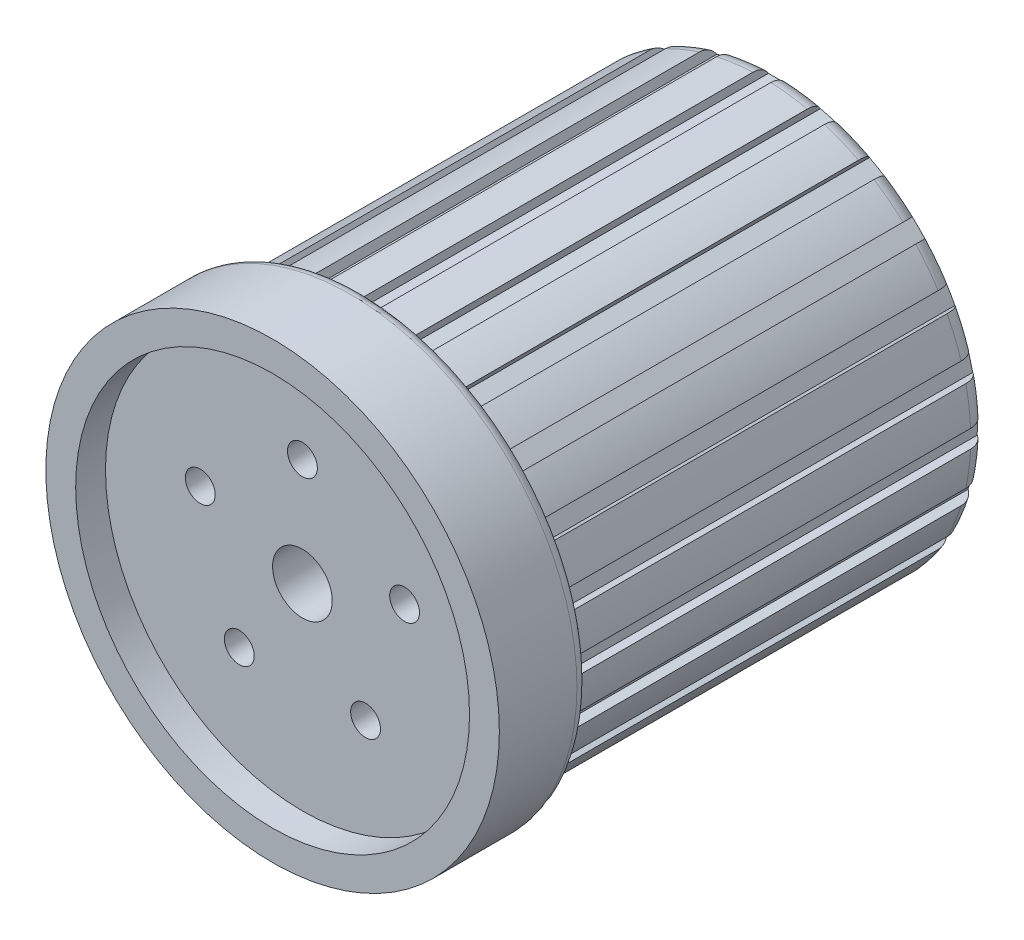
from build123d import *

# Parameters (mm, degrees)
SKETCH2_R           = 2.5
SKETCH2_R_2         = 5
CUT_EXTRUDE1_DEPTH  = 10
FILLET1_R           = 3
SKETCH3_W           = 3
SKETCH3_H           = 3
CUT_EXTRUDE2_DEPTH  = 70
SKETCH4_R           = 38
SKETCH4_R_2         = 35
BOSS_EXTRUDE1_DEPTH = 10
CIRPATTERN1_START   = -52.098076311
CIRPATTERN1_DEPTH   = 69.598076311
FILLET2_R           = 2
BOSS_EXTRUDE2_START = 5
SKETCH5_R           = 38
SKETCH5_R_2         = 33
BOSS_EXTRUDE2_DEPTH = 5


# Read off the part's stored shape, not the designer's step: CirPattern1
with BuildPart() as part:
    # Sketch1 → Revolve1 (revolve)
    with BuildSketch(Plane(origin=(0, 0, 0), x_dir=(0, 0, -1), z_dir=(1, 0, 0))):
        Polygon((-17.5, 0), (-17.5, -25), (52.5, -25), (52.5, -35), (-27.5, -35), (-27.5, 0), align=None)
    revolve(axis=Axis((0, 0, 42.5), (0, 0, -1)))

    # Sketch2 → Cut-Extrude1 (cut)
    with BuildSketch(Plane(origin=(0, 0, 17.5), x_dir=(-1, 0, 0), z_dir=(0, 0, -1))):
        with Locations(Location((0, 18, 0), (0, 0, 90))):
            Circle(SKETCH2_R)
        with Locations(Location((0, 0, 0), (0, 0, 90))):
            Circle(SKETCH2_R_2)
        with Locations(Location((17.119017293, 5.562305899, 0), (0, 0, 90))):
            Circle(SKETCH2_R)
        with Locations(Location((10.580134541, -14.562305899, 0), (0, 0, 90))):
            Circle(SKETCH2_R)
        with Locations(Location((-10.580134541, -14.562305899, 0), (0, 0, 90))):
            Circle(SKETCH2_R)
        with Locations(Location((-17.119017293, 5.562305899, 0), (0, 0, 90))):
            Circle(SKETCH2_R)
    extrude(amount=-CUT_EXTRUDE1_DEPTH, mode=Mode.SUBTRACT)

    # Fillet1
    fillet1_edges = [part.edges().sort_by_distance(p)[0] for p in [
        (0, 35, -52.5),
        (0, 25, -52.5),
    ]]
    fillet(fillet1_edges, radius=FILLET1_R)

    # Sketch3 → Cut-Extrude2 (cut)
    with BuildSketch(Plane(origin=(0, 0, -52.5), x_dir=(-1, 0, 0), z_dir=(0, 0, -1))):
        with Locations((0, 35)):
            Rectangle(SKETCH3_W, SKETCH3_H)
    extrude(amount=-CUT_EXTRUDE2_DEPTH, mode=Mode.SUBTRACT)

    # Sketch4 → Boss-Extrude1 (add)
    with BuildSketch(Plane.XY.offset(27.5)):
        Circle(SKETCH4_R)
        Circle(SKETCH4_R_2, mode=Mode.SUBTRACT)
    extrude(amount=-BOSS_EXTRUDE1_DEPTH)

    # CirPattern1 outline → CirPattern1 (cut)
    with BuildSketch(Plane.XY.offset(CIRPATTERN1_START)):
        with BuildLine():
            Line((1.5, -33.5), (-1.5, -33.5))
            Line((-1.5, -33.5), (-1.5, -34.96784237))
            ThreePointArc((-1.5, -34.96784237), (0, -35), (1.5, -34.96784237))
            Line((1.5, -34.96784237), (1.5, -33.5))
        make_face()
        with BuildLine():
            Line((10.11932675, 31.970286613), (10.499232311, 33.388113467))
            ThreePointArc((10.499232311, 33.388113467), (9.058666579, 33.80740392), (7.601454832, 34.164570602))
            Line((7.601454832, 34.164570602), (7.221549272, 32.746743748))
            Line((7.221549272, 32.746743748), (10.11932675, 31.970286613))
        make_face()
        with BuildLine():
            Line((18.049038106, 28.261851027), (18.782959291, 29.533039808))
            ThreePointArc((18.782959291, 29.533039808), (17.5, 30.310889133), (16.184883079, 31.033039808))
            Line((16.184883079, 31.033039808), (15.450961894, 29.761851027))
            Line((15.450961894, 29.761851027), (18.049038106, 28.261851027))
        make_face()
        with BuildLine():
            Line((24.748737342, 22.627416998), (25.786658635, 23.665338291))
            ThreePointArc((25.786658635, 23.665338291), (24.748737342, 24.748737342), (23.665338291, 25.786658635))
            Line((23.665338291, 25.786658635), (22.627416998, 24.748737342))
            Line((22.627416998, 24.748737342), (24.748737342, 22.627416998))
        make_face()
        with BuildLine():
            Line((29.761851027, 15.450961894), (31.033039808, 16.184883079))
            ThreePointArc((31.033039808, 16.184883079), (30.310889133, 17.5), (29.533039808, 18.782959291))
            Line((29.533039808, 18.782959291), (28.261851027, 18.049038106))
            Line((28.261851027, 18.049038106), (29.761851027, 15.450961894))
        make_face()
        with BuildLine():
            Line((32.746743748, 7.221549272), (34.164570602, 7.601454832))
            ThreePointArc((34.164570602, 7.601454832), (33.80740392, 9.058666579), (33.388113467, 10.499232311))
            Line((33.388113467, 10.499232311), (31.970286613, 10.11932675))
            Line((31.970286613, 10.11932675), (32.746743748, 7.221549272))
        make_face()
        with BuildLine():
            Line((33.5, -1.5), (34.96784237, -1.5))
            ThreePointArc((34.96784237, -1.5), (35, 0), (34.96784237, 1.5))
            Line((34.96784237, 1.5), (33.5, 1.5))
            Line((33.5, 1.5), (33.5, -1.5))
        make_face()
        with BuildLine():
            Line((31.970286613, -10.11932675), (33.388113467, -10.499232311))
            ThreePointArc((33.388113467, -10.499232311), (33.80740392, -9.058666579), (34.164570602, -7.601454832))
            Line((34.164570602, -7.601454832), (32.746743748, -7.221549272))
            Line((32.746743748, -7.221549272), (31.970286613, -10.11932675))
        make_face()
        with BuildLine():
            Line((28.261851027, -18.049038106), (29.533039808, -18.782959291))
            ThreePointArc((29.533039808, -18.782959291), (30.310889133, -17.5), (31.033039808, -16.184883079))
            Line((31.033039808, -16.184883079), (29.761851027, -15.450961894))
            Line((29.761851027, -15.450961894), (28.261851027, -18.049038106))
        make_face()
        with BuildLine():
            Line((22.627416998, -24.748737342), (23.665338291, -25.786658635))
            ThreePointArc((23.665338291, -25.786658635), (24.748737342, -24.748737342), (25.786658635, -23.665338291))
            Line((25.786658635, -23.665338291), (24.748737342, -22.627416998))
            Line((24.748737342, -22.627416998), (22.627416998, -24.748737342))
        make_face()
        with BuildLine():
            Line((15.450961894, -29.761851027), (16.184883079, -31.033039808))
            ThreePointArc((16.184883079, -31.033039808), (17.5, -30.310889132), (18.782959291, -29.533039808))
            Line((18.782959291, -29.533039808), (18.049038106, -28.261851027))
            Line((18.049038106, -28.261851027), (15.450961894, -29.761851027))
        make_face()
        with BuildLine():
            Line((7.221549272, -32.746743748), (7.601454832, -34.164570602))
            ThreePointArc((7.601454832, -34.164570602), (9.058666579, -33.80740392), (10.499232311, -33.388113467))
            Line((10.499232311, -33.388113467), (10.11932675, -31.970286613))
            Line((10.11932675, -31.970286613), (7.221549272, -32.746743748))
        make_face()
        with BuildLine():
            ThreePointArc((-7.601454832, 34.164570602), (-9.058666579, 33.80740392), (-10.499232311, 33.388113467))
            Line((-10.499232311, 33.388113467), (-10.11932675, 31.970286613))
            Line((-10.11932675, 31.970286613), (-7.221549272, 32.746743748))
            Line((-7.221549272, 32.746743748), (-7.601454832, 34.164570602))
        make_face()
        with BuildLine():
            ThreePointArc((-16.184883079, 31.033039808), (-17.5, 30.310889133), (-18.782959291, 29.533039808))
            Line((-18.782959291, 29.533039808), (-18.049038106, 28.261851027))
            Line((-18.049038106, 28.261851027), (-15.450961894, 29.761851027))
            Line((-15.450961894, 29.761851027), (-16.184883079, 31.033039808))
        make_face()
        with BuildLine():
            ThreePointArc((-23.665338291, 25.786658635), (-24.748737342, 24.748737342), (-25.786658635, 23.665338291))
            Line((-25.786658635, 23.665338291), (-24.748737342, 22.627416998))
            Line((-24.748737342, 22.627416998), (-22.627416998, 24.748737342))
            Line((-22.627416998, 24.748737342), (-23.665338291, 25.786658635))
        make_face()
        with BuildLine():
            ThreePointArc((-29.533039808, 18.782959291), (-30.310889133, 17.5), (-31.033039808, 16.184883079))
            Line((-31.033039808, 16.184883079), (-29.761851027, 15.450961894))
            Line((-29.761851027, 15.450961894), (-28.261851027, 18.049038106))
            Line((-28.261851027, 18.049038106), (-29.533039808, 18.782959291))
        make_face()
        with BuildLine():
            ThreePointArc((-33.388113467, 10.499232311), (-33.80740392, 9.058666579), (-34.164570602, 7.601454832))
            Line((-34.164570602, 7.601454832), (-32.746743748, 7.221549272))
            Line((-32.746743748, 7.221549272), (-31.970286613, 10.11932675))
            Line((-31.970286613, 10.11932675), (-33.388113467, 10.499232311))
        make_face()
        with BuildLine():
            ThreePointArc((-34.96784237, 1.5), (-35, 0), (-34.96784237, -1.5))
            Line((-34.96784237, -1.5), (-33.5, -1.5))
            Line((-33.5, -1.5), (-33.5, 1.5))
            Line((-33.5, 1.5), (-34.96784237, 1.5))
        make_face()
        with BuildLine():
            ThreePointArc((-34.164570602, -7.601454832), (-33.80740392, -9.058666579), (-33.388113467, -10.499232311))
            Line((-33.388113467, -10.499232311), (-31.970286613, -10.11932675))
            Line((-31.970286613, -10.11932675), (-32.746743748, -7.221549272))
            Line((-32.746743748, -7.221549272), (-34.164570602, -7.601454832))
        make_face()
        with BuildLine():
            ThreePointArc((-31.033039808, -16.184883079), (-30.310889133, -17.5), (-29.533039808, -18.782959291))
            Line((-29.533039808, -18.782959291), (-28.261851027, -18.049038106))
            Line((-28.261851027, -18.049038106), (-29.761851027, -15.450961894))
            Line((-29.761851027, -15.450961894), (-31.033039808, -16.184883079))
        make_face()
        with BuildLine():
            ThreePointArc((-25.786658635, -23.665338291), (-24.748737342, -24.748737342), (-23.665338291, -25.786658635))
            Line((-23.665338291, -25.786658635), (-22.627416998, -24.748737342))
            Line((-22.627416998, -24.748737342), (-24.748737342, -22.627416998))
            Line((-24.748737342, -22.627416998), (-25.786658635, -23.665338291))
        make_face()
        with BuildLine():
            ThreePointArc((-18.782959291, -29.533039808), (-17.5, -30.310889132), (-16.184883079, -31.033039808))
            Line((-16.184883079, -31.033039808), (-15.450961894, -29.761851027))
            Line((-15.450961894, -29.761851027), (-18.049038106, -28.261851027))
            Line((-18.049038106, -28.261851027), (-18.782959291, -29.533039808))
        make_face()
        with BuildLine():
            ThreePointArc((-10.499232311, -33.388113467), (-9.058666579, -33.80740392), (-7.601454832, -34.164570602))
            Line((-7.601454832, -34.164570602), (-7.221549272, -32.746743748))
            Line((-7.221549272, -32.746743748), (-10.11932675, -31.970286613))
            Line((-10.11932675, -31.970286613), (-10.499232311, -33.388113467))
        make_face()
    extrude(amount=CIRPATTERN1_DEPTH, mode=Mode.SUBTRACT)

    # Fillet2
    fillet2_edges = [part.edges().sort_by_distance(p)[0] for p in [
        (-38, 0, 17.5),
    ]]
    fillet(fillet2_edges, radius=FILLET2_R)

    # Sketch5 → Boss-Extrude2 (add)
    with BuildSketch(Plane.XY.offset(27.5).offset(BOSS_EXTRUDE2_START)):
        Circle(SKETCH5_R)
        with Locations(Location((0, 0, 0), (0, 0, 270))):
            Circle(SKETCH5_R_2, mode=Mode.SUBTRACT)
    extrude(amount=-BOSS_EXTRUDE2_DEPTH)


solid = part.part
